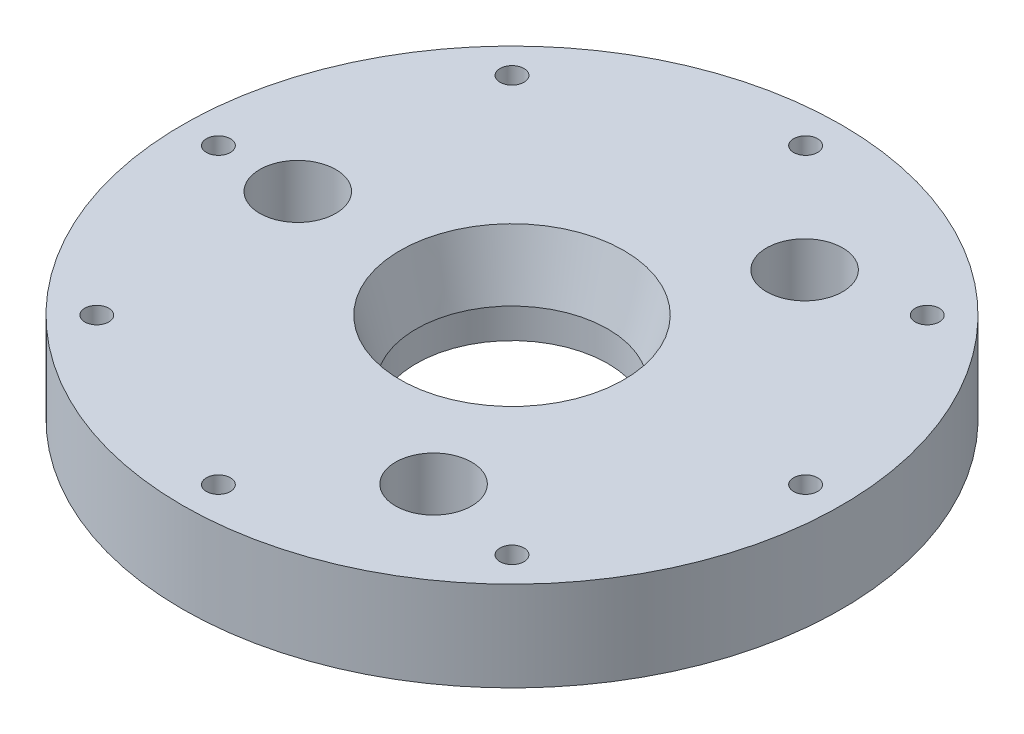
from build123d import *

# Parameters (mm, degrees)
SKETCH1_R           = 55
BOSS_EXTRUDE1_DEPTH = 15
SKETCH6_R           = 2
CUT_EXTRUDE3_DEPTH  = 80.214897589
CIRPATTERN1_COUNT   = 8
SKETCH7_R           = 6.35
CUT_EXTRUDE4_DEPTH  = 80.214897589
CIRPATTERN2_COUNT   = 3


with BuildPart() as part:
    # Sketch1 → Boss-Extrude1 (new body)
    with BuildSketch(Plane(origin=(0, 0, 0), x_dir=(1, 0, 0), z_dir=(0, 1, 0))):
        Circle(SKETCH1_R)
    extrude(amount=BOSS_EXTRUDE1_DEPTH)

    # Sketch5 → Cut-Revolve1 (revolve, cut)
    with BuildSketch(Plane.XY):
        Polygon((0, 0), (0, 15), (18.679491924, 15), (16, 5), (16, 0), align=None)
    revolve(axis=Axis((0, 0, 0), (0, 1, 0)), mode=Mode.SUBTRACT)

    # Sketch6 → Cut-Extrude3 (cut, through all)
    with BuildSketch(Plane(origin=(0, 0, 0), x_dir=(1, 0, 0), z_dir=(0, 1, 0))):
        with Locations((49, 0)):
            Circle(SKETCH6_R)
    cut_extrude3 = extrude(amount=CUT_EXTRUDE3_DEPTH, mode=Mode.SUBTRACT)

    # CirPattern1: Cut-Extrude3 ×8 about axis
    cirpattern1_axis = Axis((0, 0, 0), (0, -1, 0))
    for i in range(1, CIRPATTERN1_COUNT):
        add(cut_extrude3.rotate(cirpattern1_axis, i * 360 / CIRPATTERN1_COUNT), mode=Mode.SUBTRACT)

    # Sketch7 → Cut-Extrude4 (cut, through all)
    with BuildSketch(Plane(origin=(0, 15, 0), x_dir=(1, 0, 0), z_dir=(0, 1, 0))):
        with Locations((17.875, 30.960408185)):
            Circle(SKETCH7_R)
    cut_extrude4 = extrude(amount=-CUT_EXTRUDE4_DEPTH, mode=Mode.SUBTRACT)

    # CirPattern2: Cut-Extrude4 ×3 about axis
    cirpattern2_axis = Axis((0, 0, 0), (0, -1, 0))
    for i in range(1, CIRPATTERN2_COUNT):
        add(cut_extrude4.rotate(cirpattern2_axis, i * 360 / CIRPATTERN2_COUNT), mode=Mode.SUBTRACT)


solid = part.part
